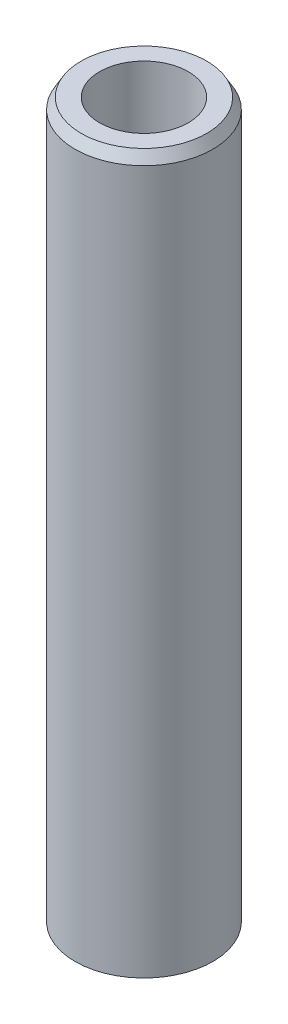
from build123d import *
from OCP.BRepFilletAPI import BRepFilletAPI_MakeChamfer

# Parameters (mm, degrees)
SKETCH1_R           = 37.5
BOSS_EXTRUDE1_DEPTH = 392.036088239
SKETCH2_R           = 24.143284617
CUT_EXTRUDE1_DEPTH  = 396.606868598
CHAMFER1_SIZE       = 5.798901473
CHAMFER1_SIZE2      = 3.347997326


with BuildPart() as part:
    # Sketch1 → Boss-Extrude1 (new body)
    with BuildSketch(Plane(origin=(0, 0, 0), x_dir=(1, 0, 0), z_dir=(0, 1, 0))):
        Circle(SKETCH1_R)
    extrude(amount=BOSS_EXTRUDE1_DEPTH)

    # Sketch2 → Cut-Extrude1 (cut, through all)
    with BuildSketch(Plane(origin=(0, 0, 0), x_dir=(1, 0, 0), z_dir=(0, 1, 0))):
        Circle(SKETCH2_R)
    extrude(amount=CUT_EXTRUDE1_DEPTH, mode=Mode.SUBTRACT)

    # Chamfer1: one chamfer whose edges measure the first distance from different faces: ONE call of the kernel's chamfer builder (chamfer() names one face for all edges)
    chamfer1_edges_1 = [part.edges().sort_by_distance(p)[0] for p in [
        (-37.5, 392.036088239, 0),
    ]]
    chamfer1_side_1 = [part.faces().sort_by_distance(p)[0] for p in [
        (-37.5, 196.018044119, 0),
    ]]
    chamfer1_edges_2 = [part.edges().sort_by_distance(p)[0] for p in [
        (-37.5, 0, 0),
    ]]
    chamfer1_side_2 = [part.faces().sort_by_distance(p)[0] for p in [
        (-36.439339828, 0, 0),
    ]]
    chamfer1 = BRepFilletAPI_MakeChamfer(part.part.solid().wrapped)
    for e in chamfer1_edges_1:
        chamfer1.Add(CHAMFER1_SIZE, CHAMFER1_SIZE2, e.wrapped, chamfer1_side_1[0].wrapped)  # the first distance lies on this face
    for e in chamfer1_edges_2:
        chamfer1.Add(CHAMFER1_SIZE, CHAMFER1_SIZE2, e.wrapped, chamfer1_side_2[0].wrapped)  # the first distance lies on this face
    add(Compound.cast(chamfer1.Shape()), mode=Mode.REPLACE)


solid = part.part
